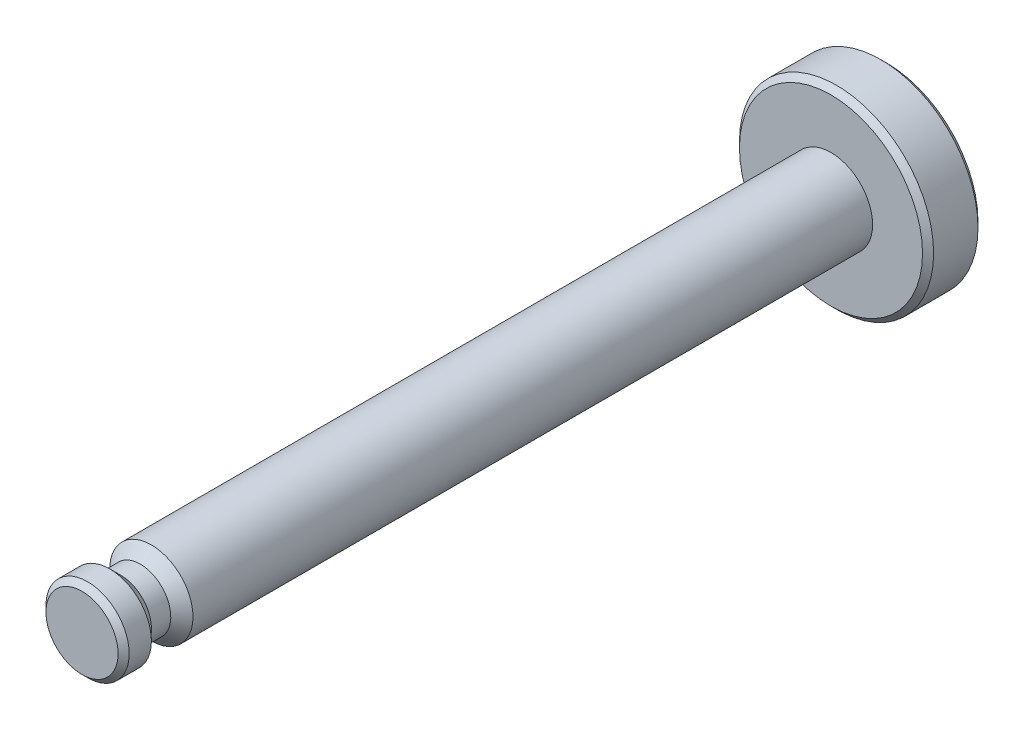
from build123d import *

# Parameters (mm, degrees)
SKETCH2_R   = 1.5
SHAFT_DEPTH = 27
SKETCH3_R   = 3.5
HEAD_DEPTH  = 2
DEBURS_SIZE = 0.2


with BuildPart() as part:
    # Sketch2 → Shaft (new body)
    with BuildSketch(Plane.XY):
        Circle(SKETCH2_R)
    extrude(amount=SHAFT_DEPTH)

    # Sketch3 → Head (add)
    with BuildSketch(Plane(origin=(0, 0, 0), x_dir=(-1, 0, 0), z_dir=(0, 0, -1))):
        Circle(SKETCH3_R)
    extrude(amount=HEAD_DEPTH)

    # Sketch4 → e-Clip Notch (revolve, cut)
    with BuildSketch(Plane(origin=(0, 0, 0), x_dir=(0, 0, -1), z_dir=(1, 0, 0))):
        Polygon((-26, 1.5), (-24.5, 1.5), (-24.9, 1.1), (-25.6, 1.1), align=None)
    revolve(axis=Axis((0, 0, 0), (0, 0, 1)), mode=Mode.SUBTRACT)

    # Deburs
    deburs_edges = [part.edges().sort_by_distance(p)[0] for p in [
        (-1.5, 0, 27),
        (3.5, 0, 0),
        (3.5, 0, -2),
    ]]
    chamfer(deburs_edges, length=DEBURS_SIZE)


solid = part.part
